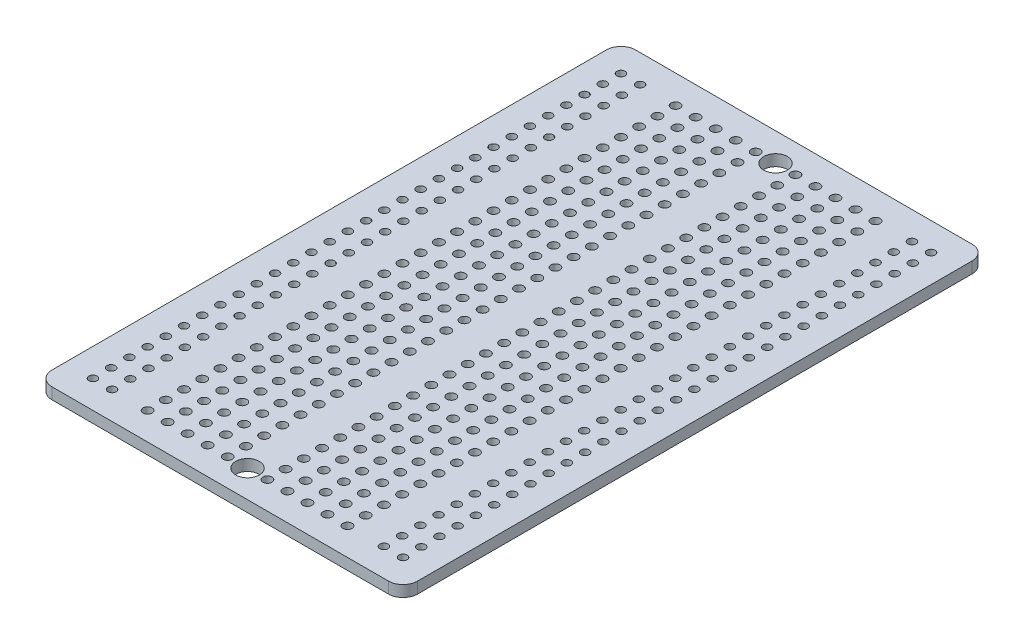
from build123d import *

# Parameters (mm, degrees)
SKETCH1_W           = 51.0032
SKETCH1_H           = 81.407
BOSS_EXTRUDE1_DEPTH = 1.5748
FILLET1_R           = 2.032
SKETCH2_R           = 0.5715
SKETCH2_R_2         = 0.635
SKETCH2_R_3         = 1.651
CUT_EXTRUDE1_DEPTH  = 97.077604333


with BuildPart() as part:
    # Sketch1 → Boss-Extrude1 (new body)
    with BuildSketch(Plane(origin=(0, 0, 0), x_dir=(1, 0, 0), z_dir=(0, 1, 0))):
        with Locations((25.5016, 40.7035)):
            Rectangle(SKETCH1_W, SKETCH1_H)
    extrude(amount=BOSS_EXTRUDE1_DEPTH)

    # Fillet1
    fillet1_edges = [part.edges().sort_by_distance(p)[0] for p in [
        (0, 0.7874, -81.407),
        (51.0032, 0.7874, -81.407),
        (51.0032, 0.7874, 0),
        (0, 0.7874, 0),
    ]]
    fillet(fillet1_edges, radius=FILLET1_R)

    # Sketch2 → Cut-Extrude1 (cut, through all)
    with BuildSketch(Plane(origin=(0, 1.5748, 0), x_dir=(1, 0, 0), z_dir=(0, 1, 0))):
        with Locations(Location((3.8735, 77.5335, 0), (0, 0, 270))):
            Circle(SKETCH2_R)
        with Locations(Location((6.5405, 77.5335, 0), (0, 0, 270))):
            Circle(SKETCH2_R)
        with Locations(Location((11.557, 77.47, 0), (0, 0, 270))):
            Circle(SKETCH2_R_2)
        with Locations(Location((14.351, 77.47, 0), (0, 0, 270))):
            Circle(SKETCH2_R_2)
        with Locations(Location((17.145, 77.47, 0), (0, 0, 270))):
            Circle(SKETCH2_R_2)
        with Locations(Location((19.939, 77.47, 0), (0, 0, 270))):
            Circle(SKETCH2_R_2)
        with Locations(Location((22.733, 77.47, 0), (0, 0, 270))):
            Circle(SKETCH2_R_2)
        with Locations(Location((47.1297, 77.5335, 0), (0, 0, 90))):
            Circle(SKETCH2_R)
        with Locations(Location((44.4627, 77.5335, 0), (0, 0, 90))):
            Circle(SKETCH2_R)
        with Locations(Location((39.4462, 77.47, 0), (0, 0, 90))):
            Circle(SKETCH2_R_2)
        with Locations(Location((36.6522, 77.47, 0), (0, 0, 90))):
            Circle(SKETCH2_R_2)
        with Locations(Location((33.8582, 77.47, 0), (0, 0, 90))):
            Circle(SKETCH2_R_2)
        with Locations(Location((31.0642, 77.47, 0), (0, 0, 90))):
            Circle(SKETCH2_R_2)
        with Locations(Location((28.2702, 77.47, 0), (0, 0, 90))):
            Circle(SKETCH2_R_2)
        with Locations(Location((3.8735, 74.9935, 0), (0, 0, 270))):
            Circle(SKETCH2_R)
        with Locations(Location((6.5405, 74.9935, 0), (0, 0, 270))):
            Circle(SKETCH2_R)
        with Locations(Location((11.557, 74.93, 0), (0, 0, 270))):
            Circle(SKETCH2_R_2)
        with Locations(Location((14.351, 74.93, 0), (0, 0, 270))):
            Circle(SKETCH2_R_2)
        with Locations(Location((17.145, 74.93, 0), (0, 0, 270))):
            Circle(SKETCH2_R_2)
        with Locations(Location((19.939, 74.93, 0), (0, 0, 270))):
            Circle(SKETCH2_R_2)
        with Locations(Location((22.733, 74.93, 0), (0, 0, 270))):
            Circle(SKETCH2_R_2)
        with Locations(Location((28.2702, 74.93, 0), (0, 0, 90))):
            Circle(SKETCH2_R_2)
        with Locations(Location((31.0642, 74.93, 0), (0, 0, 90))):
            Circle(SKETCH2_R_2)
        with Locations(Location((33.8582, 74.93, 0), (0, 0, 90))):
            Circle(SKETCH2_R_2)
        with Locations(Location((36.6522, 74.93, 0), (0, 0, 90))):
            Circle(SKETCH2_R_2)
        with Locations(Location((39.4462, 74.93, 0), (0, 0, 90))):
            Circle(SKETCH2_R_2)
        with Locations(Location((44.4627, 74.9935, 0), (0, 0, 90))):
            Circle(SKETCH2_R)
        with Locations(Location((47.1297, 74.9935, 0), (0, 0, 90))):
            Circle(SKETCH2_R)
        with Locations(Location((3.8735, 72.4535, 0), (0, 0, 270))):
            Circle(SKETCH2_R)
        with Locations(Location((6.5405, 72.4535, 0), (0, 0, 270))):
            Circle(SKETCH2_R)
        with Locations(Location((11.557, 72.39, 0), (0, 0, 270))):
            Circle(SKETCH2_R_2)
        with Locations(Location((14.351, 72.39, 0), (0, 0, 270))):
            Circle(SKETCH2_R_2)
        with Locations(Location((17.145, 72.39, 0), (0, 0, 270))):
            Circle(SKETCH2_R_2)
        with Locations(Location((19.939, 72.39, 0), (0, 0, 270))):
            Circle(SKETCH2_R_2)
        with Locations(Location((22.733, 72.39, 0), (0, 0, 270))):
            Circle(SKETCH2_R_2)
        with Locations(Location((28.2702, 72.39, 0), (0, 0, 90))):
            Circle(SKETCH2_R_2)
        with Locations(Location((31.0642, 72.39, 0), (0, 0, 90))):
            Circle(SKETCH2_R_2)
        with Locations(Location((33.8582, 72.39, 0), (0, 0, 90))):
            Circle(SKETCH2_R_2)
        with Locations(Location((36.6522, 72.39, 0), (0, 0, 90))):
            Circle(SKETCH2_R_2)
        with Locations(Location((39.4462, 72.39, 0), (0, 0, 90))):
            Circle(SKETCH2_R_2)
        with Locations(Location((44.4627, 72.4535, 0), (0, 0, 90))):
            Circle(SKETCH2_R)
        with Locations(Location((47.1297, 72.4535, 0), (0, 0, 90))):
            Circle(SKETCH2_R)
        with Locations(Location((3.8735, 69.9135, 0), (0, 0, 270))):
            Circle(SKETCH2_R)
        with Locations(Location((6.5405, 69.9135, 0), (0, 0, 270))):
            Circle(SKETCH2_R)
        with Locations(Location((11.557, 69.85, 0), (0, 0, 270))):
            Circle(SKETCH2_R_2)
        with Locations(Location((14.351, 69.85, 0), (0, 0, 270))):
            Circle(SKETCH2_R_2)
        with Locations(Location((17.145, 69.85, 0), (0, 0, 270))):
            Circle(SKETCH2_R_2)
        with Locations(Location((19.939, 69.85, 0), (0, 0, 270))):
            Circle(SKETCH2_R_2)
        with Locations(Location((22.733, 69.85, 0), (0, 0, 270))):
            Circle(SKETCH2_R_2)
        with Locations(Location((28.2702, 69.85, 0), (0, 0, 90))):
            Circle(SKETCH2_R_2)
        with Locations(Location((31.0642, 69.85, 0), (0, 0, 90))):
            Circle(SKETCH2_R_2)
        with Locations(Location((33.8582, 69.85, 0), (0, 0, 90))):
            Circle(SKETCH2_R_2)
        with Locations(Location((36.6522, 69.85, 0), (0, 0, 90))):
            Circle(SKETCH2_R_2)
        with Locations(Location((39.4462, 69.85, 0), (0, 0, 90))):
            Circle(SKETCH2_R_2)
        with Locations(Location((44.4627, 69.9135, 0), (0, 0, 90))):
            Circle(SKETCH2_R)
        with Locations(Location((47.1297, 69.9135, 0), (0, 0, 90))):
            Circle(SKETCH2_R)
        with Locations(Location((3.8735, 67.3735, 0), (0, 0, 270))):
            Circle(SKETCH2_R)
        with Locations(Location((6.5405, 67.3735, 0), (0, 0, 270))):
            Circle(SKETCH2_R)
        with Locations(Location((11.557, 67.31, 0), (0, 0, 270))):
            Circle(SKETCH2_R_2)
        with Locations(Location((14.351, 67.31, 0), (0, 0, 270))):
            Circle(SKETCH2_R_2)
        with Locations(Location((17.145, 67.31, 0), (0, 0, 270))):
            Circle(SKETCH2_R_2)
        with Locations(Location((19.939, 67.31, 0), (0, 0, 270))):
            Circle(SKETCH2_R_2)
        with Locations(Location((22.733, 67.31, 0), (0, 0, 270))):
            Circle(SKETCH2_R_2)
        with Locations(Location((28.2702, 67.31, 0), (0, 0, 90))):
            Circle(SKETCH2_R_2)
        with Locations(Location((31.0642, 67.31, 0), (0, 0, 90))):
            Circle(SKETCH2_R_2)
        with Locations(Location((33.8582, 67.31, 0), (0, 0, 90))):
            Circle(SKETCH2_R_2)
        with Locations(Location((36.6522, 67.31, 0), (0, 0, 90))):
            Circle(SKETCH2_R_2)
        with Locations(Location((39.4462, 67.31, 0), (0, 0, 90))):
            Circle(SKETCH2_R_2)
        with Locations(Location((44.4627, 67.3735, 0), (0, 0, 90))):
            Circle(SKETCH2_R)
        with Locations(Location((47.1297, 67.3735, 0), (0, 0, 90))):
            Circle(SKETCH2_R)
        with Locations(Location((3.8735, 64.8335, 0), (0, 0, 270))):
            Circle(SKETCH2_R)
        with Locations(Location((6.5405, 64.8335, 0), (0, 0, 270))):
            Circle(SKETCH2_R)
        with Locations(Location((11.557, 64.77, 0), (0, 0, 270))):
            Circle(SKETCH2_R_2)
        with Locations(Location((14.351, 64.77, 0), (0, 0, 270))):
            Circle(SKETCH2_R_2)
        with Locations(Location((17.145, 64.77, 0), (0, 0, 270))):
            Circle(SKETCH2_R_2)
        with Locations(Location((19.939, 64.77, 0), (0, 0, 270))):
            Circle(SKETCH2_R_2)
        with Locations(Location((22.733, 64.77, 0), (0, 0, 270))):
            Circle(SKETCH2_R_2)
        with Locations(Location((28.2702, 64.77, 0), (0, 0, 90))):
            Circle(SKETCH2_R_2)
        with Locations(Location((31.0642, 64.77, 0), (0, 0, 90))):
            Circle(SKETCH2_R_2)
        with Locations(Location((33.8582, 64.77, 0), (0, 0, 90))):
            Circle(SKETCH2_R_2)
        with Locations(Location((36.6522, 64.77, 0), (0, 0, 90))):
            Circle(SKETCH2_R_2)
        with Locations(Location((39.4462, 64.77, 0), (0, 0, 90))):
            Circle(SKETCH2_R_2)
        with Locations(Location((44.4627, 64.8335, 0), (0, 0, 90))):
            Circle(SKETCH2_R)
        with Locations(Location((47.1297, 64.8335, 0), (0, 0, 90))):
            Circle(SKETCH2_R)
        with Locations(Location((3.8735, 62.2935, 0), (0, 0, 270))):
            Circle(SKETCH2_R)
        with Locations(Location((6.5405, 62.2935, 0), (0, 0, 270))):
            Circle(SKETCH2_R)
        with Locations(Location((11.557, 62.23, 0), (0, 0, 270))):
            Circle(SKETCH2_R_2)
        with Locations(Location((14.351, 62.23, 0), (0, 0, 270))):
            Circle(SKETCH2_R_2)
        with Locations(Location((17.145, 62.23, 0), (0, 0, 270))):
            Circle(SKETCH2_R_2)
        with Locations(Location((19.939, 62.23, 0), (0, 0, 270))):
            Circle(SKETCH2_R_2)
        with Locations(Location((22.733, 62.23, 0), (0, 0, 270))):
            Circle(SKETCH2_R_2)
        with Locations(Location((28.2702, 62.23, 0), (0, 0, 90))):
            Circle(SKETCH2_R_2)
        with Locations(Location((31.0642, 62.23, 0), (0, 0, 90))):
            Circle(SKETCH2_R_2)
        with Locations(Location((33.8582, 62.23, 0), (0, 0, 90))):
            Circle(SKETCH2_R_2)
        with Locations(Location((36.6522, 62.23, 0), (0, 0, 90))):
            Circle(SKETCH2_R_2)
        with Locations(Location((39.4462, 62.23, 0), (0, 0, 90))):
            Circle(SKETCH2_R_2)
        with Locations(Location((44.4627, 62.2935, 0), (0, 0, 90))):
            Circle(SKETCH2_R)
        with Locations(Location((47.1297, 62.2935, 0), (0, 0, 90))):
            Circle(SKETCH2_R)
        with Locations(Location((3.8735, 59.7535, 0), (0, 0, 270))):
            Circle(SKETCH2_R)
        with Locations(Location((6.5405, 59.7535, 0), (0, 0, 270))):
            Circle(SKETCH2_R)
        with Locations(Location((11.557, 59.69, 0), (0, 0, 270))):
            Circle(SKETCH2_R_2)
        with Locations(Location((14.351, 59.69, 0), (0, 0, 270))):
            Circle(SKETCH2_R_2)
        with Locations(Location((17.145, 59.69, 0), (0, 0, 270))):
            Circle(SKETCH2_R_2)
        with Locations(Location((19.939, 59.69, 0), (0, 0, 270))):
            Circle(SKETCH2_R_2)
        with Locations(Location((22.733, 59.69, 0), (0, 0, 270))):
            Circle(SKETCH2_R_2)
        with Locations(Location((28.2702, 59.69, 0), (0, 0, 90))):
            Circle(SKETCH2_R_2)
        with Locations(Location((31.0642, 59.69, 0), (0, 0, 90))):
            Circle(SKETCH2_R_2)
        with Locations(Location((33.8582, 59.69, 0), (0, 0, 90))):
            Circle(SKETCH2_R_2)
        with Locations(Location((36.6522, 59.69, 0), (0, 0, 90))):
            Circle(SKETCH2_R_2)
        with Locations(Location((39.4462, 59.69, 0), (0, 0, 90))):
            Circle(SKETCH2_R_2)
        with Locations(Location((44.4627, 59.7535, 0), (0, 0, 90))):
            Circle(SKETCH2_R)
        with Locations(Location((47.1297, 59.7535, 0), (0, 0, 90))):
            Circle(SKETCH2_R)
        with Locations(Location((3.8735, 57.2135, 0), (0, 0, 270))):
            Circle(SKETCH2_R)
        with Locations(Location((6.5405, 57.2135, 0), (0, 0, 270))):
            Circle(SKETCH2_R)
        with Locations(Location((11.557, 57.15, 0), (0, 0, 270))):
            Circle(SKETCH2_R_2)
        with Locations(Location((14.351, 57.15, 0), (0, 0, 270))):
            Circle(SKETCH2_R_2)
        with Locations(Location((17.145, 57.15, 0), (0, 0, 270))):
            Circle(SKETCH2_R_2)
        with Locations(Location((19.939, 57.15, 0), (0, 0, 270))):
            Circle(SKETCH2_R_2)
        with Locations(Location((22.733, 57.15, 0), (0, 0, 270))):
            Circle(SKETCH2_R_2)
        with Locations(Location((28.2702, 57.15, 0), (0, 0, 90))):
            Circle(SKETCH2_R_2)
        with Locations(Location((31.0642, 57.15, 0), (0, 0, 90))):
            Circle(SKETCH2_R_2)
        with Locations(Location((33.8582, 57.15, 0), (0, 0, 90))):
            Circle(SKETCH2_R_2)
        with Locations(Location((36.6522, 57.15, 0), (0, 0, 90))):
            Circle(SKETCH2_R_2)
        with Locations(Location((39.4462, 57.15, 0), (0, 0, 90))):
            Circle(SKETCH2_R_2)
        with Locations(Location((44.4627, 57.2135, 0), (0, 0, 90))):
            Circle(SKETCH2_R)
        with Locations(Location((47.1297, 57.2135, 0), (0, 0, 90))):
            Circle(SKETCH2_R)
        with Locations(Location((3.8735, 54.6735, 0), (0, 0, 270))):
            Circle(SKETCH2_R)
        with Locations(Location((6.5405, 54.6735, 0), (0, 0, 270))):
            Circle(SKETCH2_R)
        with Locations(Location((11.557, 54.61, 0), (0, 0, 270))):
            Circle(SKETCH2_R_2)
        with Locations(Location((14.351, 54.61, 0), (0, 0, 270))):
            Circle(SKETCH2_R_2)
        with Locations(Location((17.145, 54.61, 0), (0, 0, 270))):
            Circle(SKETCH2_R_2)
        with Locations(Location((19.939, 54.61, 0), (0, 0, 270))):
            Circle(SKETCH2_R_2)
        with Locations(Location((22.733, 54.61, 0), (0, 0, 270))):
            Circle(SKETCH2_R_2)
        with Locations(Location((28.2702, 54.61, 0), (0, 0, 90))):
            Circle(SKETCH2_R_2)
        with Locations(Location((31.0642, 54.61, 0), (0, 0, 90))):
            Circle(SKETCH2_R_2)
        with Locations(Location((33.8582, 54.61, 0), (0, 0, 90))):
            Circle(SKETCH2_R_2)
        with Locations(Location((36.6522, 54.61, 0), (0, 0, 90))):
            Circle(SKETCH2_R_2)
        with Locations(Location((39.4462, 54.61, 0), (0, 0, 90))):
            Circle(SKETCH2_R_2)
        with Locations(Location((44.4627, 54.6735, 0), (0, 0, 90))):
            Circle(SKETCH2_R)
        with Locations(Location((47.1297, 54.6735, 0), (0, 0, 90))):
            Circle(SKETCH2_R)
        with Locations(Location((3.8735, 52.1335, 0), (0, 0, 270))):
            Circle(SKETCH2_R)
        with Locations(Location((6.5405, 52.1335, 0), (0, 0, 270))):
            Circle(SKETCH2_R)
        with Locations(Location((11.557, 52.07, 0), (0, 0, 270))):
            Circle(SKETCH2_R_2)
        with Locations(Location((14.351, 52.07, 0), (0, 0, 270))):
            Circle(SKETCH2_R_2)
        with Locations(Location((17.145, 52.07, 0), (0, 0, 270))):
            Circle(SKETCH2_R_2)
        with Locations(Location((19.939, 52.07, 0), (0, 0, 270))):
            Circle(SKETCH2_R_2)
        with Locations(Location((22.733, 52.07, 0), (0, 0, 270))):
            Circle(SKETCH2_R_2)
        with Locations(Location((28.2702, 52.07, 0), (0, 0, 90))):
            Circle(SKETCH2_R_2)
        with Locations(Location((31.0642, 52.07, 0), (0, 0, 90))):
            Circle(SKETCH2_R_2)
        with Locations(Location((33.8582, 52.07, 0), (0, 0, 90))):
            Circle(SKETCH2_R_2)
        with Locations(Location((36.6522, 52.07, 0), (0, 0, 90))):
            Circle(SKETCH2_R_2)
        with Locations(Location((39.4462, 52.07, 0), (0, 0, 90))):
            Circle(SKETCH2_R_2)
        with Locations(Location((44.4627, 52.1335, 0), (0, 0, 90))):
            Circle(SKETCH2_R)
        with Locations(Location((47.1297, 52.1335, 0), (0, 0, 90))):
            Circle(SKETCH2_R)
        with Locations(Location((3.8735, 49.5935, 0), (0, 0, 270))):
            Circle(SKETCH2_R)
        with Locations(Location((6.5405, 49.5935, 0), (0, 0, 270))):
            Circle(SKETCH2_R)
        with Locations(Location((11.557, 49.53, 0), (0, 0, 270))):
            Circle(SKETCH2_R_2)
        with Locations(Location((14.351, 49.53, 0), (0, 0, 270))):
            Circle(SKETCH2_R_2)
        with Locations(Location((17.145, 49.53, 0), (0, 0, 270))):
            Circle(SKETCH2_R_2)
        with Locations(Location((19.939, 49.53, 0), (0, 0, 270))):
            Circle(SKETCH2_R_2)
        with Locations(Location((22.733, 49.53, 0), (0, 0, 270))):
            Circle(SKETCH2_R_2)
        with Locations(Location((28.2702, 49.53, 0), (0, 0, 90))):
            Circle(SKETCH2_R_2)
        with Locations(Location((31.0642, 49.53, 0), (0, 0, 90))):
            Circle(SKETCH2_R_2)
        with Locations(Location((33.8582, 49.53, 0), (0, 0, 90))):
            Circle(SKETCH2_R_2)
        with Locations(Location((36.6522, 49.53, 0), (0, 0, 90))):
            Circle(SKETCH2_R_2)
        with Locations(Location((39.4462, 49.53, 0), (0, 0, 90))):
            Circle(SKETCH2_R_2)
        with Locations(Location((44.4627, 49.5935, 0), (0, 0, 90))):
            Circle(SKETCH2_R)
        with Locations(Location((47.1297, 49.5935, 0), (0, 0, 90))):
            Circle(SKETCH2_R)
        with Locations(Location((3.8735, 47.0535, 0), (0, 0, 270))):
            Circle(SKETCH2_R)
        with Locations(Location((6.5405, 47.0535, 0), (0, 0, 270))):
            Circle(SKETCH2_R)
        with Locations(Location((11.557, 46.99, 0), (0, 0, 270))):
            Circle(SKETCH2_R_2)
        with Locations(Location((14.351, 46.99, 0), (0, 0, 270))):
            Circle(SKETCH2_R_2)
        with Locations(Location((17.145, 46.99, 0), (0, 0, 270))):
            Circle(SKETCH2_R_2)
        with Locations(Location((19.939, 46.99, 0), (0, 0, 270))):
            Circle(SKETCH2_R_2)
        with Locations(Location((22.733, 46.99, 0), (0, 0, 270))):
            Circle(SKETCH2_R_2)
        with Locations(Location((28.2702, 46.99, 0), (0, 0, 90))):
            Circle(SKETCH2_R_2)
        with Locations(Location((31.0642, 46.99, 0), (0, 0, 90))):
            Circle(SKETCH2_R_2)
        with Locations(Location((33.8582, 46.99, 0), (0, 0, 90))):
            Circle(SKETCH2_R_2)
        with Locations(Location((36.6522, 46.99, 0), (0, 0, 90))):
            Circle(SKETCH2_R_2)
        with Locations(Location((39.4462, 46.99, 0), (0, 0, 90))):
            Circle(SKETCH2_R_2)
        with Locations(Location((44.4627, 47.0535, 0), (0, 0, 90))):
            Circle(SKETCH2_R)
        with Locations(Location((47.1297, 47.0535, 0), (0, 0, 90))):
            Circle(SKETCH2_R)
        with Locations(Location((3.8735, 44.5135, 0), (0, 0, 270))):
            Circle(SKETCH2_R)
        with Locations(Location((6.5405, 44.5135, 0), (0, 0, 270))):
            Circle(SKETCH2_R)
        with Locations(Location((11.557, 44.45, 0), (0, 0, 270))):
            Circle(SKETCH2_R_2)
        with Locations(Location((14.351, 44.45, 0), (0, 0, 270))):
            Circle(SKETCH2_R_2)
        with Locations(Location((17.145, 44.45, 0), (0, 0, 270))):
            Circle(SKETCH2_R_2)
        with Locations(Location((19.939, 44.45, 0), (0, 0, 270))):
            Circle(SKETCH2_R_2)
        with Locations(Location((22.733, 44.45, 0), (0, 0, 270))):
            Circle(SKETCH2_R_2)
        with Locations(Location((28.2702, 44.45, 0), (0, 0, 90))):
            Circle(SKETCH2_R_2)
        with Locations(Location((31.0642, 44.45, 0), (0, 0, 90))):
            Circle(SKETCH2_R_2)
        with Locations(Location((33.8582, 44.45, 0), (0, 0, 90))):
            Circle(SKETCH2_R_2)
        with Locations(Location((36.6522, 44.45, 0), (0, 0, 90))):
            Circle(SKETCH2_R_2)
        with Locations(Location((39.4462, 44.45, 0), (0, 0, 90))):
            Circle(SKETCH2_R_2)
        with Locations(Location((44.4627, 44.5135, 0), (0, 0, 90))):
            Circle(SKETCH2_R)
        with Locations(Location((47.1297, 44.5135, 0), (0, 0, 90))):
            Circle(SKETCH2_R)
        with Locations(Location((3.8735, 41.9735, 0), (0, 0, 270))):
            Circle(SKETCH2_R)
        with Locations(Location((6.5405, 41.9735, 0), (0, 0, 270))):
            Circle(SKETCH2_R)
        with Locations(Location((11.557, 41.91, 0), (0, 0, 270))):
            Circle(SKETCH2_R_2)
        with Locations(Location((14.351, 41.91, 0), (0, 0, 270))):
            Circle(SKETCH2_R_2)
        with Locations(Location((17.145, 41.91, 0), (0, 0, 270))):
            Circle(SKETCH2_R_2)
        with Locations(Location((19.939, 41.91, 0), (0, 0, 270))):
            Circle(SKETCH2_R_2)
        with Locations(Location((22.733, 41.91, 0), (0, 0, 270))):
            Circle(SKETCH2_R_2)
        with Locations(Location((28.2702, 41.91, 0), (0, 0, 90))):
            Circle(SKETCH2_R_2)
        with Locations(Location((31.0642, 41.91, 0), (0, 0, 90))):
            Circle(SKETCH2_R_2)
        with Locations(Location((33.8582, 41.91, 0), (0, 0, 90))):
            Circle(SKETCH2_R_2)
        with Locations(Location((36.6522, 41.91, 0), (0, 0, 90))):
            Circle(SKETCH2_R_2)
        with Locations(Location((39.4462, 41.91, 0), (0, 0, 90))):
            Circle(SKETCH2_R_2)
        with Locations(Location((44.4627, 41.9735, 0), (0, 0, 90))):
            Circle(SKETCH2_R)
        with Locations(Location((47.1297, 41.9735, 0), (0, 0, 90))):
            Circle(SKETCH2_R)
        with Locations(Location((3.8735, 39.4335, 0), (0, 0, 270))):
            Circle(SKETCH2_R)
        with Locations(Location((6.5405, 39.4335, 0), (0, 0, 270))):
            Circle(SKETCH2_R)
        with Locations(Location((11.557, 39.37, 0), (0, 0, 270))):
            Circle(SKETCH2_R_2)
        with Locations(Location((14.351, 39.37, 0), (0, 0, 270))):
            Circle(SKETCH2_R_2)
        with Locations(Location((17.145, 39.37, 0), (0, 0, 270))):
            Circle(SKETCH2_R_2)
        with Locations(Location((19.939, 39.37, 0), (0, 0, 270))):
            Circle(SKETCH2_R_2)
        with Locations(Location((22.733, 39.37, 0), (0, 0, 270))):
            Circle(SKETCH2_R_2)
        with Locations(Location((28.2702, 39.37, 0), (0, 0, 90))):
            Circle(SKETCH2_R_2)
        with Locations(Location((31.0642, 39.37, 0), (0, 0, 90))):
            Circle(SKETCH2_R_2)
        with Locations(Location((33.8582, 39.37, 0), (0, 0, 90))):
            Circle(SKETCH2_R_2)
        with Locations(Location((36.6522, 39.37, 0), (0, 0, 90))):
            Circle(SKETCH2_R_2)
        with Locations(Location((39.4462, 39.37, 0), (0, 0, 90))):
            Circle(SKETCH2_R_2)
        with Locations(Location((44.4627, 39.4335, 0), (0, 0, 90))):
            Circle(SKETCH2_R)
        with Locations(Location((47.1297, 39.4335, 0), (0, 0, 90))):
            Circle(SKETCH2_R)
        with Locations(Location((3.8735, 36.8935, 0), (0, 0, 270))):
            Circle(SKETCH2_R)
        with Locations(Location((6.5405, 36.8935, 0), (0, 0, 270))):
            Circle(SKETCH2_R)
        with Locations(Location((11.557, 36.83, 0), (0, 0, 270))):
            Circle(SKETCH2_R_2)
        with Locations(Location((14.351, 36.83, 0), (0, 0, 270))):
            Circle(SKETCH2_R_2)
        with Locations(Location((17.145, 36.83, 0), (0, 0, 270))):
            Circle(SKETCH2_R_2)
        with Locations(Location((19.939, 36.83, 0), (0, 0, 270))):
            Circle(SKETCH2_R_2)
        with Locations(Location((22.733, 36.83, 0), (0, 0, 270))):
            Circle(SKETCH2_R_2)
        with Locations(Location((28.2702, 36.83, 0), (0, 0, 90))):
            Circle(SKETCH2_R_2)
        with Locations(Location((31.0642, 36.83, 0), (0, 0, 90))):
            Circle(SKETCH2_R_2)
        with Locations(Location((33.8582, 36.83, 0), (0, 0, 90))):
            Circle(SKETCH2_R_2)
        with Locations(Location((36.6522, 36.83, 0), (0, 0, 90))):
            Circle(SKETCH2_R_2)
        with Locations(Location((39.4462, 36.83, 0), (0, 0, 90))):
            Circle(SKETCH2_R_2)
        with Locations(Location((44.4627, 36.8935, 0), (0, 0, 90))):
            Circle(SKETCH2_R)
        with Locations(Location((47.1297, 36.8935, 0), (0, 0, 90))):
            Circle(SKETCH2_R)
        with Locations(Location((3.8735, 34.3535, 0), (0, 0, 270))):
            Circle(SKETCH2_R)
        with Locations(Location((6.5405, 34.3535, 0), (0, 0, 270))):
            Circle(SKETCH2_R)
        with Locations(Location((11.557, 34.29, 0), (0, 0, 270))):
            Circle(SKETCH2_R_2)
        with Locations(Location((14.351, 34.29, 0), (0, 0, 270))):
            Circle(SKETCH2_R_2)
        with Locations(Location((17.145, 34.29, 0), (0, 0, 270))):
            Circle(SKETCH2_R_2)
        with Locations(Location((19.939, 34.29, 0), (0, 0, 270))):
            Circle(SKETCH2_R_2)
        with Locations(Location((22.733, 34.29, 0), (0, 0, 270))):
            Circle(SKETCH2_R_2)
        with Locations(Location((28.2702, 34.29, 0), (0, 0, 90))):
            Circle(SKETCH2_R_2)
        with Locations(Location((31.0642, 34.29, 0), (0, 0, 90))):
            Circle(SKETCH2_R_2)
        with Locations(Location((33.8582, 34.29, 0), (0, 0, 90))):
            Circle(SKETCH2_R_2)
        with Locations(Location((36.6522, 34.29, 0), (0, 0, 90))):
            Circle(SKETCH2_R_2)
        with Locations(Location((39.4462, 34.29, 0), (0, 0, 90))):
            Circle(SKETCH2_R_2)
        with Locations(Location((44.4627, 34.3535, 0), (0, 0, 90))):
            Circle(SKETCH2_R)
        with Locations(Location((47.1297, 34.3535, 0), (0, 0, 90))):
            Circle(SKETCH2_R)
        with Locations(Location((3.8735, 31.8135, 0), (0, 0, 270))):
            Circle(SKETCH2_R)
        with Locations(Location((6.5405, 31.8135, 0), (0, 0, 270))):
            Circle(SKETCH2_R)
        with Locations(Location((11.557, 31.75, 0), (0, 0, 270))):
            Circle(SKETCH2_R_2)
        with Locations(Location((14.351, 31.75, 0), (0, 0, 270))):
            Circle(SKETCH2_R_2)
        with Locations(Location((17.145, 31.75, 0), (0, 0, 270))):
            Circle(SKETCH2_R_2)
        with Locations(Location((19.939, 31.75, 0), (0, 0, 270))):
            Circle(SKETCH2_R_2)
        with Locations(Location((22.733, 31.75, 0), (0, 0, 270))):
            Circle(SKETCH2_R_2)
        with Locations(Location((28.2702, 31.75, 0), (0, 0, 90))):
            Circle(SKETCH2_R_2)
        with Locations(Location((31.0642, 31.75, 0), (0, 0, 90))):
            Circle(SKETCH2_R_2)
        with Locations(Location((33.8582, 31.75, 0), (0, 0, 90))):
            Circle(SKETCH2_R_2)
        with Locations(Location((36.6522, 31.75, 0), (0, 0, 90))):
            Circle(SKETCH2_R_2)
        with Locations(Location((39.4462, 31.75, 0), (0, 0, 90))):
            Circle(SKETCH2_R_2)
        with Locations(Location((44.4627, 31.8135, 0), (0, 0, 90))):
            Circle(SKETCH2_R)
        with Locations(Location((47.1297, 31.8135, 0), (0, 0, 90))):
            Circle(SKETCH2_R)
        with Locations(Location((3.8735, 29.2735, 0), (0, 0, 270))):
            Circle(SKETCH2_R)
        with Locations(Location((6.5405, 29.2735, 0), (0, 0, 270))):
            Circle(SKETCH2_R)
        with Locations(Location((11.557, 29.21, 0), (0, 0, 270))):
            Circle(SKETCH2_R_2)
        with Locations(Location((14.351, 29.21, 0), (0, 0, 270))):
            Circle(SKETCH2_R_2)
        with Locations(Location((17.145, 29.21, 0), (0, 0, 270))):
            Circle(SKETCH2_R_2)
        with Locations(Location((19.939, 29.21, 0), (0, 0, 270))):
            Circle(SKETCH2_R_2)
        with Locations(Location((22.733, 29.21, 0), (0, 0, 270))):
            Circle(SKETCH2_R_2)
        with Locations(Location((28.2702, 29.21, 0), (0, 0, 90))):
            Circle(SKETCH2_R_2)
        with Locations(Location((31.0642, 29.21, 0), (0, 0, 90))):
            Circle(SKETCH2_R_2)
        with Locations(Location((33.8582, 29.21, 0), (0, 0, 90))):
            Circle(SKETCH2_R_2)
        with Locations(Location((36.6522, 29.21, 0), (0, 0, 90))):
            Circle(SKETCH2_R_2)
        with Locations(Location((39.4462, 29.21, 0), (0, 0, 90))):
            Circle(SKETCH2_R_2)
        with Locations(Location((44.4627, 29.2735, 0), (0, 0, 90))):
            Circle(SKETCH2_R)
        with Locations(Location((47.1297, 29.2735, 0), (0, 0, 90))):
            Circle(SKETCH2_R)
        with Locations(Location((3.8735, 26.7335, 0), (0, 0, 270))):
            Circle(SKETCH2_R)
        with Locations(Location((6.5405, 26.7335, 0), (0, 0, 270))):
            Circle(SKETCH2_R)
        with Locations(Location((11.557, 26.67, 0), (0, 0, 270))):
            Circle(SKETCH2_R_2)
        with Locations(Location((14.351, 26.67, 0), (0, 0, 270))):
            Circle(SKETCH2_R_2)
        with Locations(Location((17.145, 26.67, 0), (0, 0, 270))):
            Circle(SKETCH2_R_2)
        with Locations(Location((19.939, 26.67, 0), (0, 0, 270))):
            Circle(SKETCH2_R_2)
        with Locations(Location((22.733, 26.67, 0), (0, 0, 270))):
            Circle(SKETCH2_R_2)
        with Locations(Location((28.2702, 26.67, 0), (0, 0, 90))):
            Circle(SKETCH2_R_2)
        with Locations(Location((31.0642, 26.67, 0), (0, 0, 90))):
            Circle(SKETCH2_R_2)
        with Locations(Location((33.8582, 26.67, 0), (0, 0, 90))):
            Circle(SKETCH2_R_2)
        with Locations(Location((36.6522, 26.67, 0), (0, 0, 90))):
            Circle(SKETCH2_R_2)
        with Locations(Location((39.4462, 26.67, 0), (0, 0, 90))):
            Circle(SKETCH2_R_2)
        with Locations(Location((44.4627, 26.7335, 0), (0, 0, 90))):
            Circle(SKETCH2_R)
        with Locations(Location((47.1297, 26.7335, 0), (0, 0, 90))):
            Circle(SKETCH2_R)
        with Locations(Location((3.8735, 24.1935, 0), (0, 0, 270))):
            Circle(SKETCH2_R)
        with Locations(Location((6.5405, 24.1935, 0), (0, 0, 270))):
            Circle(SKETCH2_R)
        with Locations(Location((11.557, 24.13, 0), (0, 0, 270))):
            Circle(SKETCH2_R_2)
        with Locations(Location((14.351, 24.13, 0), (0, 0, 270))):
            Circle(SKETCH2_R_2)
        with Locations(Location((17.145, 24.13, 0), (0, 0, 270))):
            Circle(SKETCH2_R_2)
        with Locations(Location((19.939, 24.13, 0), (0, 0, 270))):
            Circle(SKETCH2_R_2)
        with Locations(Location((22.733, 24.13, 0), (0, 0, 270))):
            Circle(SKETCH2_R_2)
        with Locations(Location((28.2702, 24.13, 0), (0, 0, 90))):
            Circle(SKETCH2_R_2)
        with Locations(Location((31.0642, 24.13, 0), (0, 0, 90))):
            Circle(SKETCH2_R_2)
        with Locations(Location((33.8582, 24.13, 0), (0, 0, 90))):
            Circle(SKETCH2_R_2)
        with Locations(Location((36.6522, 24.13, 0), (0, 0, 90))):
            Circle(SKETCH2_R_2)
        with Locations(Location((39.4462, 24.13, 0), (0, 0, 90))):
            Circle(SKETCH2_R_2)
        with Locations(Location((44.4627, 24.1935, 0), (0, 0, 90))):
            Circle(SKETCH2_R)
        with Locations(Location((47.1297, 24.1935, 0), (0, 0, 90))):
            Circle(SKETCH2_R)
        with Locations(Location((3.8735, 21.6535, 0), (0, 0, 270))):
            Circle(SKETCH2_R)
        with Locations(Location((6.5405, 21.6535, 0), (0, 0, 270))):
            Circle(SKETCH2_R)
        with Locations(Location((11.557, 21.59, 0), (0, 0, 270))):
            Circle(SKETCH2_R_2)
        with Locations(Location((14.351, 21.59, 0), (0, 0, 270))):
            Circle(SKETCH2_R_2)
        with Locations(Location((17.145, 21.59, 0), (0, 0, 270))):
            Circle(SKETCH2_R_2)
        with Locations(Location((19.939, 21.59, 0), (0, 0, 270))):
            Circle(SKETCH2_R_2)
        with Locations(Location((22.733, 21.59, 0), (0, 0, 270))):
            Circle(SKETCH2_R_2)
        with Locations(Location((28.2702, 21.59, 0), (0, 0, 90))):
            Circle(SKETCH2_R_2)
        with Locations(Location((31.0642, 21.59, 0), (0, 0, 90))):
            Circle(SKETCH2_R_2)
        with Locations(Location((33.8582, 21.59, 0), (0, 0, 90))):
            Circle(SKETCH2_R_2)
        with Locations(Location((36.6522, 21.59, 0), (0, 0, 90))):
            Circle(SKETCH2_R_2)
        with Locations(Location((39.4462, 21.59, 0), (0, 0, 90))):
            Circle(SKETCH2_R_2)
        with Locations(Location((44.4627, 21.6535, 0), (0, 0, 90))):
            Circle(SKETCH2_R)
        with Locations(Location((47.1297, 21.6535, 0), (0, 0, 90))):
            Circle(SKETCH2_R)
        with Locations(Location((3.8735, 19.1135, 0), (0, 0, 270))):
            Circle(SKETCH2_R)
        with Locations(Location((6.5405, 19.1135, 0), (0, 0, 270))):
            Circle(SKETCH2_R)
        with Locations(Location((11.557, 19.05, 0), (0, 0, 270))):
            Circle(SKETCH2_R_2)
        with Locations(Location((14.351, 19.05, 0), (0, 0, 270))):
            Circle(SKETCH2_R_2)
        with Locations(Location((17.145, 19.05, 0), (0, 0, 270))):
            Circle(SKETCH2_R_2)
        with Locations(Location((19.939, 19.05, 0), (0, 0, 270))):
            Circle(SKETCH2_R_2)
        with Locations(Location((22.733, 19.05, 0), (0, 0, 270))):
            Circle(SKETCH2_R_2)
        with Locations(Location((28.2702, 19.05, 0), (0, 0, 90))):
            Circle(SKETCH2_R_2)
        with Locations(Location((31.0642, 19.05, 0), (0, 0, 90))):
            Circle(SKETCH2_R_2)
        with Locations(Location((33.8582, 19.05, 0), (0, 0, 90))):
            Circle(SKETCH2_R_2)
        with Locations(Location((36.6522, 19.05, 0), (0, 0, 90))):
            Circle(SKETCH2_R_2)
        with Locations(Location((39.4462, 19.05, 0), (0, 0, 90))):
            Circle(SKETCH2_R_2)
        with Locations(Location((44.4627, 19.1135, 0), (0, 0, 90))):
            Circle(SKETCH2_R)
        with Locations(Location((47.1297, 19.1135, 0), (0, 0, 90))):
            Circle(SKETCH2_R)
        with Locations(Location((3.8735, 16.5735, 0), (0, 0, 270))):
            Circle(SKETCH2_R)
        with Locations(Location((6.5405, 16.5735, 0), (0, 0, 270))):
            Circle(SKETCH2_R)
        with Locations(Location((11.557, 16.51, 0), (0, 0, 270))):
            Circle(SKETCH2_R_2)
        with Locations(Location((14.351, 16.51, 0), (0, 0, 270))):
            Circle(SKETCH2_R_2)
        with Locations(Location((17.145, 16.51, 0), (0, 0, 270))):
            Circle(SKETCH2_R_2)
        with Locations(Location((19.939, 16.51, 0), (0, 0, 270))):
            Circle(SKETCH2_R_2)
        with Locations(Location((22.733, 16.51, 0), (0, 0, 270))):
            Circle(SKETCH2_R_2)
        with Locations(Location((28.2702, 16.51, 0), (0, 0, 90))):
            Circle(SKETCH2_R_2)
        with Locations(Location((31.0642, 16.51, 0), (0, 0, 90))):
            Circle(SKETCH2_R_2)
        with Locations(Location((33.8582, 16.51, 0), (0, 0, 90))):
            Circle(SKETCH2_R_2)
        with Locations(Location((36.6522, 16.51, 0), (0, 0, 90))):
            Circle(SKETCH2_R_2)
        with Locations(Location((39.4462, 16.51, 0), (0, 0, 90))):
            Circle(SKETCH2_R_2)
        with Locations(Location((44.4627, 16.5735, 0), (0, 0, 90))):
            Circle(SKETCH2_R)
        with Locations(Location((47.1297, 16.5735, 0), (0, 0, 90))):
            Circle(SKETCH2_R)
        with Locations(Location((3.8735, 14.0335, 0), (0, 0, 270))):
            Circle(SKETCH2_R)
        with Locations(Location((6.5405, 14.0335, 0), (0, 0, 270))):
            Circle(SKETCH2_R)
        with Locations(Location((11.557, 13.97, 0), (0, 0, 270))):
            Circle(SKETCH2_R_2)
        with Locations(Location((14.351, 13.97, 0), (0, 0, 270))):
            Circle(SKETCH2_R_2)
        with Locations(Location((17.145, 13.97, 0), (0, 0, 270))):
            Circle(SKETCH2_R_2)
        with Locations(Location((19.939, 13.97, 0), (0, 0, 270))):
            Circle(SKETCH2_R_2)
        with Locations(Location((22.733, 13.97, 0), (0, 0, 270))):
            Circle(SKETCH2_R_2)
        with Locations(Location((28.2702, 13.97, 0), (0, 0, 90))):
            Circle(SKETCH2_R_2)
        with Locations(Location((31.0642, 13.97, 0), (0, 0, 90))):
            Circle(SKETCH2_R_2)
        with Locations(Location((33.8582, 13.97, 0), (0, 0, 90))):
            Circle(SKETCH2_R_2)
        with Locations(Location((36.6522, 13.97, 0), (0, 0, 90))):
            Circle(SKETCH2_R_2)
        with Locations(Location((39.4462, 13.97, 0), (0, 0, 90))):
            Circle(SKETCH2_R_2)
        with Locations(Location((44.4627, 14.0335, 0), (0, 0, 90))):
            Circle(SKETCH2_R)
        with Locations(Location((47.1297, 14.0335, 0), (0, 0, 90))):
            Circle(SKETCH2_R)
        with Locations(Location((3.8735, 11.4935, 0), (0, 0, 270))):
            Circle(SKETCH2_R)
        with Locations(Location((6.5405, 11.4935, 0), (0, 0, 270))):
            Circle(SKETCH2_R)
        with Locations(Location((11.557, 11.43, 0), (0, 0, 270))):
            Circle(SKETCH2_R_2)
        with Locations(Location((14.351, 11.43, 0), (0, 0, 270))):
            Circle(SKETCH2_R_2)
        with Locations(Location((17.145, 11.43, 0), (0, 0, 270))):
            Circle(SKETCH2_R_2)
        with Locations(Location((19.939, 11.43, 0), (0, 0, 270))):
            Circle(SKETCH2_R_2)
        with Locations(Location((22.733, 11.43, 0), (0, 0, 270))):
            Circle(SKETCH2_R_2)
        with Locations(Location((28.2702, 11.43, 0), (0, 0, 90))):
            Circle(SKETCH2_R_2)
        with Locations(Location((31.0642, 11.43, 0), (0, 0, 90))):
            Circle(SKETCH2_R_2)
        with Locations(Location((33.8582, 11.43, 0), (0, 0, 90))):
            Circle(SKETCH2_R_2)
        with Locations(Location((36.6522, 11.43, 0), (0, 0, 90))):
            Circle(SKETCH2_R_2)
        with Locations(Location((39.4462, 11.43, 0), (0, 0, 90))):
            Circle(SKETCH2_R_2)
        with Locations(Location((44.4627, 11.4935, 0), (0, 0, 90))):
            Circle(SKETCH2_R)
        with Locations(Location((47.1297, 11.4935, 0), (0, 0, 90))):
            Circle(SKETCH2_R)
        with Locations(Location((3.8735, 8.9535, 0), (0, 0, 270))):
            Circle(SKETCH2_R)
        with Locations(Location((6.5405, 8.9535, 0), (0, 0, 270))):
            Circle(SKETCH2_R)
        with Locations(Location((11.557, 8.89, 0), (0, 0, 270))):
            Circle(SKETCH2_R_2)
        with Locations(Location((14.351, 8.89, 0), (0, 0, 270))):
            Circle(SKETCH2_R_2)
        with Locations(Location((17.145, 8.89, 0), (0, 0, 270))):
            Circle(SKETCH2_R_2)
        with Locations(Location((19.939, 8.89, 0), (0, 0, 270))):
            Circle(SKETCH2_R_2)
        with Locations(Location((22.733, 8.89, 0), (0, 0, 270))):
            Circle(SKETCH2_R_2)
        with Locations(Location((28.2702, 8.89, 0), (0, 0, 90))):
            Circle(SKETCH2_R_2)
        with Locations(Location((31.0642, 8.89, 0), (0, 0, 90))):
            Circle(SKETCH2_R_2)
        with Locations(Location((33.8582, 8.89, 0), (0, 0, 90))):
            Circle(SKETCH2_R_2)
        with Locations(Location((36.6522, 8.89, 0), (0, 0, 90))):
            Circle(SKETCH2_R_2)
        with Locations(Location((39.4462, 8.89, 0), (0, 0, 90))):
            Circle(SKETCH2_R_2)
        with Locations(Location((44.4627, 8.9535, 0), (0, 0, 90))):
            Circle(SKETCH2_R)
        with Locations(Location((47.1297, 8.9535, 0), (0, 0, 90))):
            Circle(SKETCH2_R)
        with Locations(Location((3.8735, 6.4135, 0), (0, 0, 270))):
            Circle(SKETCH2_R)
        with Locations(Location((6.5405, 6.4135, 0), (0, 0, 270))):
            Circle(SKETCH2_R)
        with Locations(Location((11.557, 6.35, 0), (0, 0, 270))):
            Circle(SKETCH2_R_2)
        with Locations(Location((14.351, 6.35, 0), (0, 0, 270))):
            Circle(SKETCH2_R_2)
        with Locations(Location((17.145, 6.35, 0), (0, 0, 270))):
            Circle(SKETCH2_R_2)
        with Locations(Location((19.939, 6.35, 0), (0, 0, 270))):
            Circle(SKETCH2_R_2)
        with Locations(Location((22.733, 6.35, 0), (0, 0, 270))):
            Circle(SKETCH2_R_2)
        with Locations(Location((28.2702, 6.35, 0), (0, 0, 90))):
            Circle(SKETCH2_R_2)
        with Locations(Location((31.0642, 6.35, 0), (0, 0, 90))):
            Circle(SKETCH2_R_2)
        with Locations(Location((33.8582, 6.35, 0), (0, 0, 90))):
            Circle(SKETCH2_R_2)
        with Locations(Location((36.6522, 6.35, 0), (0, 0, 90))):
            Circle(SKETCH2_R_2)
        with Locations(Location((39.4462, 6.35, 0), (0, 0, 90))):
            Circle(SKETCH2_R_2)
        with Locations(Location((44.4627, 6.4135, 0), (0, 0, 90))):
            Circle(SKETCH2_R)
        with Locations(Location((47.1297, 6.4135, 0), (0, 0, 90))):
            Circle(SKETCH2_R)
        with Locations(Location((3.8735, 3.8735, 0), (0, 0, 270))):
            Circle(SKETCH2_R)
        with Locations(Location((6.5405, 3.8735, 0), (0, 0, 270))):
            Circle(SKETCH2_R)
        with Locations(Location((11.557, 3.81, 0), (0, 0, 270))):
            Circle(SKETCH2_R_2)
        with Locations(Location((14.351, 3.81, 0), (0, 0, 270))):
            Circle(SKETCH2_R_2)
        with Locations(Location((17.145, 3.81, 0), (0, 0, 270))):
            Circle(SKETCH2_R_2)
        with Locations(Location((19.939, 3.81, 0), (0, 0, 270))):
            Circle(SKETCH2_R_2)
        with Locations(Location((22.733, 3.81, 0), (0, 0, 270))):
            Circle(SKETCH2_R_2)
        with Locations(Location((28.2702, 3.81, 0), (0, 0, 90))):
            Circle(SKETCH2_R_2)
        with Locations(Location((31.0642, 3.81, 0), (0, 0, 90))):
            Circle(SKETCH2_R_2)
        with Locations(Location((33.8582, 3.81, 0), (0, 0, 90))):
            Circle(SKETCH2_R_2)
        with Locations(Location((36.6522, 3.81, 0), (0, 0, 90))):
            Circle(SKETCH2_R_2)
        with Locations(Location((39.4462, 3.81, 0), (0, 0, 90))):
            Circle(SKETCH2_R_2)
        with Locations(Location((44.4627, 3.8735, 0), (0, 0, 90))):
            Circle(SKETCH2_R)
        with Locations(Location((47.1297, 3.8735, 0), (0, 0, 90))):
            Circle(SKETCH2_R)
        with Locations(Location((25.5016, 77.47, 0), (0, 0, 270))):
            Circle(SKETCH2_R_3)
        with Locations(Location((25.5016, 3.81, 0), (0, 0, 270))):
            Circle(SKETCH2_R_3)
    extrude(amount=-CUT_EXTRUDE1_DEPTH, mode=Mode.SUBTRACT)


solid = part.part
